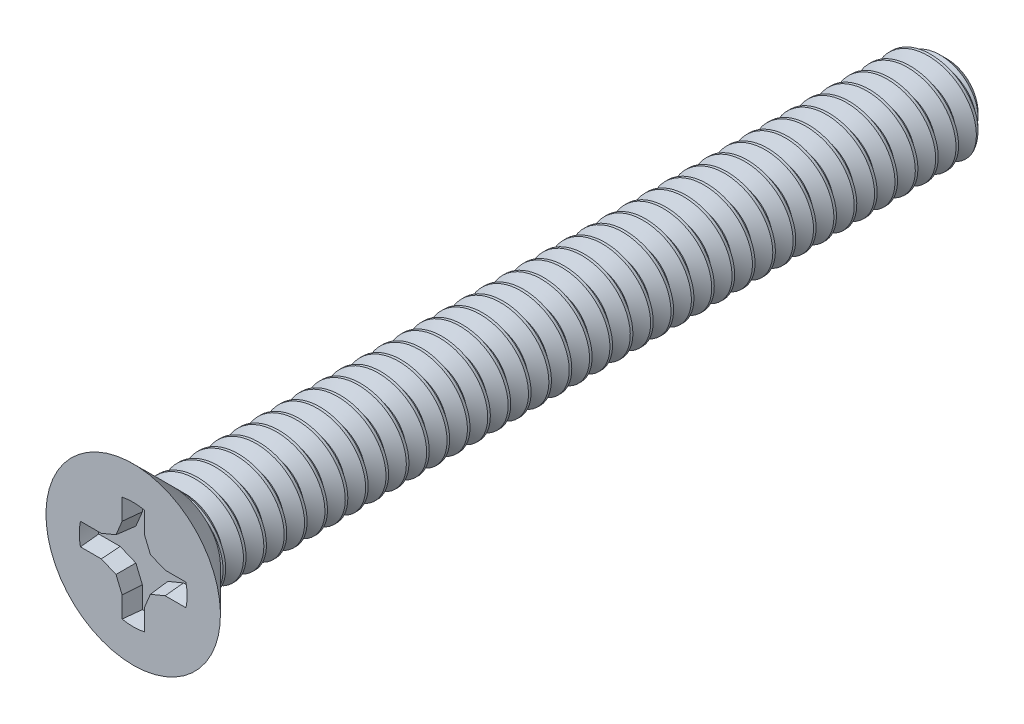
from build123d import *

# Parameters (mm, degrees)
CUT_EXTRUDE1_DEPTH  = 0.32
CIRPATTERN1_COUNT   = 4
DRAFT2_ANGLE        = 5
CUT_SWEEP1_PITCH    = 0.35
CUT_SWEEP1_TO       = 13.3
SKETCH8_R           = 0.8
BOSS_EXTRUDE1_DEPTH = 0.26
BOSS_EXTRUDE1_DRAFT = -45


with BuildPart() as part:
    # Sketch3 → Revolve1 (revolve)
    with BuildSketch(Plane(origin=(0, 0, 0), x_dir=(0, 0, -1), z_dir=(1, 0, 0)), mode=Mode.PRIVATE) as revolve1_sk:
        Polygon((-0.96, 0), (-0.96, 1.5), (-0.26, 0.8), (-0.26, 0), align=None)
    revolve(revolve1_sk.sketch.rotate(Axis((0, 0, 0.96), (0, 0, -1)), 180), axis=Axis((0, 0, 0.96), (0, 0, -1)))

    # Sketch5 → Revolve2 (revolve)
    with BuildSketch(Plane(origin=(0, 0, 0), x_dir=(0, 0, -1), z_dir=(1, 0, 0))):
        Polygon((13.04, 0), (-0.26, 0), (-0.26, 0.8), (12.7635, 0.8), (13.04, 0.5235), align=None)
    revolve(axis=Axis((0, 0, -13.04), (0, 0, 1)))

    # Sketch4 → Cut-Extrude1 (cut)
    with BuildSketch(Plane.XY.offset(0.96)):
        with BuildLine():
            Line((0, 0), (0.9271, 0))
            ThreePointArc((0.9271, 0), (0.92214099, 0.095762227), (0.907317012, 0.1905))
            Line((0.907317012, 0.1905), (0.548908506, 0.1905))
            Line((0.548908506, 0.1905), (0.295475421, 0.295475421))
            Line((0.295475421, 0.295475421), (0.1905, 0.548908506))
            Line((0.1905, 0.548908506), (0.1905, 0.907317012))
            ThreePointArc((0.1905, 0.907317012), (0.095762227, 0.92214099), (0, 0.9271))
            Line((0, 0.9271), (0, 0))
        make_face()
    cut_extrude1 = extrude(amount=-CUT_EXTRUDE1_DEPTH, mode=Mode.SUBTRACT)

    # CirPattern1: Cut-Extrude1 ×4 about axis
    cirpattern1_axis = Axis((0, 0, 0), (0, 0, 1))
    for i in range(1, CIRPATTERN1_COUNT):
        add(cut_extrude1.rotate(cirpattern1_axis, i * 360 / CIRPATTERN1_COUNT), mode=Mode.SUBTRACT)

    # Draft2
    draft2_faces = [part.faces().sort_by_distance(p)[0] for p in [
        (-0.728112759, 0.1905, 0.8),
        (-0.422191963, 0.24298771, 0.8),
        (-0.24298771, 0.422191963, 0.8),
        (-0.1905, 0.728112759, 0.8),
        (0.1905, 0.728112759, 0.8),
        (0.24298771, 0.422191963, 0.8),
        (0.422191963, 0.24298771, 0.8),
        (0.728112759, 0.1905, 0.8),
        (0.728112759, -0.1905, 0.8),
        (0.422191963, -0.24298771, 0.8),
        (0.24298771, -0.422191963, 0.8),
        (0.1905, -0.728112759, 0.8),
        (-0.1905, -0.728112759, 0.8),
        (-0.24298771, -0.422191963, 0.8),
        (-0.422191963, -0.24298771, 0.8),
        (-0.728112759, -0.1905, 0.8),
    ]]
    draft(draft2_faces, Plane(origin=(0, 0, 0.96), x_dir=(0, 1, 0), z_dir=(0, 0, 1)), DRAFT2_ANGLE)


with BuildPart() as body_2:
    # Split1: the piece on the far side of the plane
    add(part.part)
    split(bisect_by=Plane(origin=(0, 0, 0.26), x_dir=(0, -1, 0), z_dir=(0, 0, -1)), keep=Keep.BOTTOM)


with BuildPart() as part_1:
    add(part.part)

    # Split1
    split(bisect_by=Plane(origin=(0, 0, 0.26), x_dir=(0, -1, 0), z_dir=(0, 0, -1)), keep=Keep.TOP)

    # Cut-Sweep1: arcs per turn and ends read off the stored shape
    # Cut-Sweep1: the profile of Sketch7 screwed along a right-hand helix through 40 turns, 6 arcs to a turn; built about Z, then put on its axis
    cut_sweep1_z = Axis((0, 0, 0), (0, 0, 1))
    cut_sweep1_corners = [(0.572668332, 0, -0.175), (0.572668332, 0, -0.13125), (0.818944306, 0, 0.0109375), (0.818944306, 0, -0.3171875)]
    with BuildLine(mode=Mode.PRIVATE) as cut_sweep1_profile:
        Line(cut_sweep1_corners[0], cut_sweep1_corners[1])
        Line(cut_sweep1_corners[1], cut_sweep1_corners[2])
        Line(cut_sweep1_corners[2], cut_sweep1_corners[3])
        Line(cut_sweep1_corners[3], cut_sweep1_corners[0])
    cut_sweep1_cap = Face(cut_sweep1_profile.wire())
    cut_sweep1_turn_angles = [0, 30, 60, 90, 120, 150, 180, 210, 240, 270, 300, 330, 360]
    cut_sweep1_turn_weights = [1, 0.8660254037844387, 1, 0.8660254037844387, 1, 0.8660254037844387, 1, 0.8660254037844387, 1, 0.8660254037844387, 1, 0.8660254037844387, 1]
    cut_sweep1_turn_rails = [Edge.make_bspline([Vector(p[0], p[1], 0).rotate(cut_sweep1_z, cut_sweep1_turn_angles[k]) / cut_sweep1_turn_weights[k] + Vector(0, 0, p[2] + CUT_SWEEP1_PITCH * cut_sweep1_turn_angles[k] / 360) for k in range(13)], [0, 0, 0, 1, 1, 2, 2, 3, 3, 4, 4, 5, 5, 6, 6, 6], 2, cut_sweep1_turn_weights) for p in cut_sweep1_corners]
    cut_sweep1_turn_sides = [Face.make_surface_from_curves(cut_sweep1_turn_rails[p[0]], cut_sweep1_turn_rails[p[1]]) for p in [(0, 1), (1, 2), (2, 3), (3, 0)]]
    cut_sweep1 = Plane(origin=(0, 0, -13.04), x_dir=(0, 1, 0), z_dir=(0, 0, 1)) * split(Solid(Shell([*[p.moved(Location((0, 0, CUT_SWEEP1_PITCH * i))) for i in range(40) for p in cut_sweep1_turn_sides], cut_sweep1_cap, cut_sweep1_cap.rotate(cut_sweep1_z, 14400).moved(Location((0, 0, CUT_SWEEP1_PITCH * 14400 / 360)))])), bisect_by=Plane.XY.offset(CUT_SWEEP1_TO), keep=Keep.BOTTOM, mode=Mode.PRIVATE)
    add(cut_sweep1, mode=Mode.SUBTRACT)


with BuildPart() as body_2_1:
    add(body_2.part)

    # Combine1: union part
    add(part_1.part)


with BuildPart() as boss_extrude1_tool:
    # Sketch8 → Boss-Extrude1 (with draft: the straight prism first)
    with BuildSketch(Plane.XY.offset(0.26)):
        Circle(SKETCH8_R)
    extrude(amount=-BOSS_EXTRUDE1_DEPTH)
    # Boss-Extrude1: the draft: its side faces are tilted about the plane it starts from
    boss_extrude1_sides = [boss_extrude1_tool.faces().sort_by_distance(p)[0] for p in [
        (-0.8, 0, 0.13),
    ]]
    draft(boss_extrude1_sides, Plane.XY.offset(0.26), BOSS_EXTRUDE1_DRAFT)


with BuildPart() as body_2_2:
    add(body_2_1.part)

    # Boss-Extrude1: add boss_extrude1_tool
    add(boss_extrude1_tool.part)


solid = body_2_2.part
